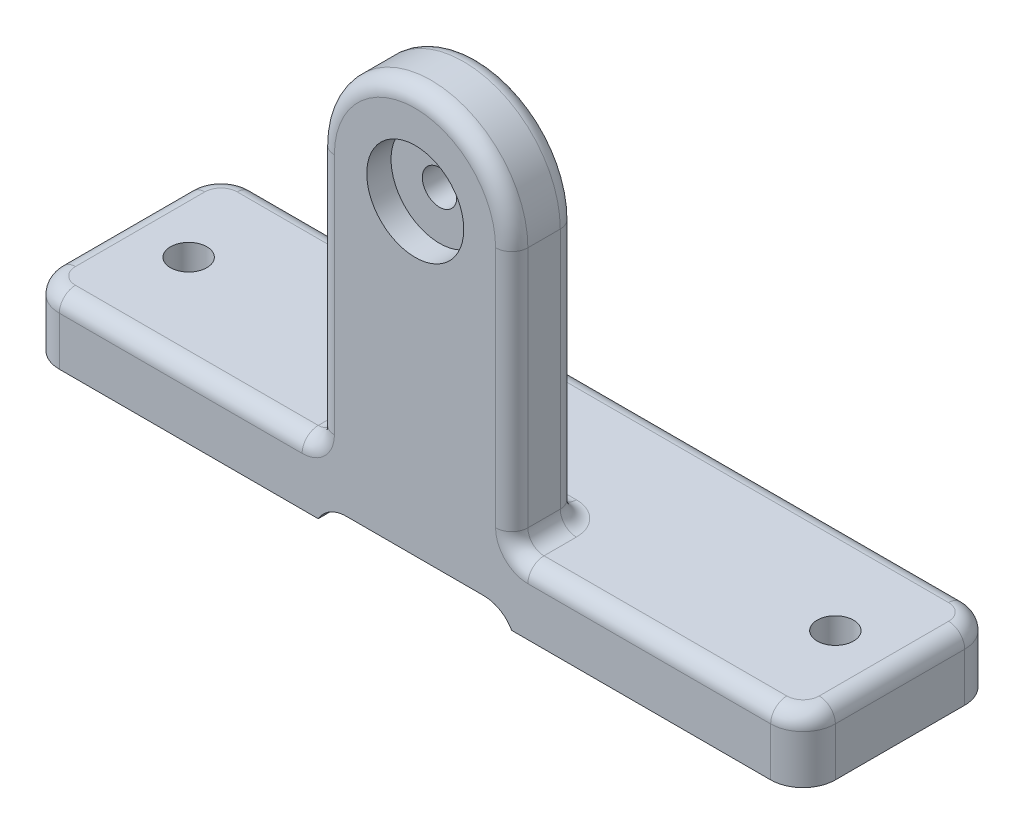
from build123d import *

# Parameters (mm, degrees)
SKETCH1_W                                = 152.4
SKETCH1_H                                = 38.1
BASEPLATE_DEPTH                          = 12.7
VERTBOSS_DEPTH                           = 12.7
F_9_32_0_28125_DIAMETER_HOLE1_D          = 7.14375
CBORE_FOR_1_4_HEX_HEAD_BOLT1_D           = 6.7564
CBORE_FOR_1_4_HEX_HEAD_BOLT1_CBORE_D     = 19.05
CBORE_FOR_1_4_HEX_HEAD_BOLT1_CBORE_DEPTH = 4.7752
SKETCH11_W                               = 38
SKETCH11_H                               = 3.17
BOTTOMSLOT_DEPTH                         = 178.43624207
FILLET1_R                                = 6.35
FILLET2_R                                = 3.17


with BuildPart() as part:
    # Sketch1 → BasePlate (new body)
    with BuildSketch(Plane(origin=(0, 0, 0), x_dir=(1, 0, 0), z_dir=(0, 1, 0))):
        with Locations((76.2, 19.05)):
            Rectangle(SKETCH1_W, SKETCH1_H)
    extrude(amount=BASEPLATE_DEPTH)

    # Sketch3 → VertBoss (add)
    with BuildSketch(Plane.XY):
        with BuildLine():
            Line((57.2, 0), (57.2, 63.5))
            ThreePointArc((57.2, 63.5), (76.2, 82.5), (95.2, 63.5))
            Line((95.2, 63.5), (95.2, 0))
            Line((95.2, 0), (57.2, 0))
        make_face()
    extrude(amount=-VERTBOSS_DEPTH)

    # 9/32 (0.28125) Diameter Hole1 (through all)
    with Locations(Plane(origin=(0, 12.7, 0), x_dir=(1, 0, 0), z_dir=(0, 1, 0))):
        with Locations((139.7, 19.05), (12.7, 19.05)):
            Hole(F_9_32_0_28125_DIAMETER_HOLE1_D / 2)

    # CBORE for 1/4 Hex Head Bolt1 (through all)
    with Locations(Plane.XY):
        with Locations((76.24706856, 63.487087048)):
            CounterBoreHole(CBORE_FOR_1_4_HEX_HEAD_BOLT1_D / 2, CBORE_FOR_1_4_HEX_HEAD_BOLT1_CBORE_D / 2, CBORE_FOR_1_4_HEX_HEAD_BOLT1_CBORE_DEPTH)

    # Sketch11 → BottomSlot (cut, through all)
    with BuildSketch(Plane.XY):
        with Locations((76.2, 1.585)):
            Rectangle(SKETCH11_W, SKETCH11_H)
    extrude(amount=-BOTTOMSLOT_DEPTH, mode=Mode.SUBTRACT)

    # Fillet1
    # the kernel refuses this fillet: 6.35 mm, written as the material it adds along each edge
    with BuildSketch(Plane(origin=(95.2, 3.17, 0), x_dir=(-1, 0, 0), z_dir=(0, 0, -1))) as fillet1_piece_1:
        with BuildLine():
            CenterArc((5.49637153, -6.35), FILLET1_R, 90, 59.947892244)
            Line((0, -3.17), (0, 0))
            Line((0, 0), (5.49637153, 0))
        make_face()
    extrude(amount=38.1)
    with BuildSketch(Plane(origin=(57.2, 3.17, 0), x_dir=(0, -1, 0), z_dir=(0, 0, -1))) as fillet1_piece_2:
        with BuildLine():
            CenterArc((6.35, -5.49637153), FILLET1_R, 120.052107756, 59.947892244)
            Line((0, -5.49637153), (0, 0))
            Line((0, 0), (3.17, 0))
        make_face()
    extrude(amount=38.1)
    # the kernel refuses this fillet: 6.35 mm, written as the material it takes off along each edge
    with BuildSketch(Plane(origin=(0, -15.875, -38.1), x_dir=(0, 0, 1), z_dir=(0, 1, 0)), Plane(origin=(0, -15.875, 0), x_dir=(1, 0, 0), z_dir=(0, 1, 0))) as fillet1_2_piece_1:
        with BuildLine():
            CenterArc((FILLET1_R, FILLET1_R), FILLET1_R, 180, 90)
            Line((0, FILLET1_R), (0, 0))
            Line((0, 0), (FILLET1_R, 0))
        make_face()
    extrude(amount=44.45, mode=Mode.SUBTRACT)
    with BuildSketch(Plane(origin=(152.4, -15.875, -38.1), x_dir=(0, 0, 1), z_dir=(0, 1, 0)), Plane(origin=(152.4, -15.875, 0), x_dir=(-1, 0, 0), z_dir=(0, 1, 0))) as fillet1_2_piece_2:
        with BuildLine():
            CenterArc((FILLET1_R, -FILLET1_R), FILLET1_R, 90, 90)
            Line((0, -FILLET1_R), (0, 0))
            Line((0, 0), (FILLET1_R, 0))
        make_face()
    extrude(amount=44.45, mode=Mode.SUBTRACT)

    # Fillet2
    fillet2_edges = [part.edges().sort_by_distance(p)[0] for p in [
        (120.625, 12.7, 0),
        (57.2, 38.1, -12.7),
        (95.2, 38.1, -12.7),
        (57.2, 38.1, 0),
        (95.2, 38.1, 0),
        (76.2, 82.5, 0),
        (57.2, 12.7, -6.35),
        (76.2, 82.5, -12.7),
        (95.2, 12.7, -6.35),
        (76.2, 12.7, -12.7),
        (0, 12.7, -19.05),
        (76.2, 12.7, -38.1),
        (31.775, 12.7, 0),
        (152.4, 12.7, -19.05),
        (150.540128061, 12.7, -1.859871939),
        (150.540128061, 12.7, -36.240128061),
        (1.859871939, 12.7, -1.859871939),
        (1.859871939, 12.7, -36.240128061),
    ]]
    fillet(fillet2_edges, radius=FILLET2_R)


solid = part.part
